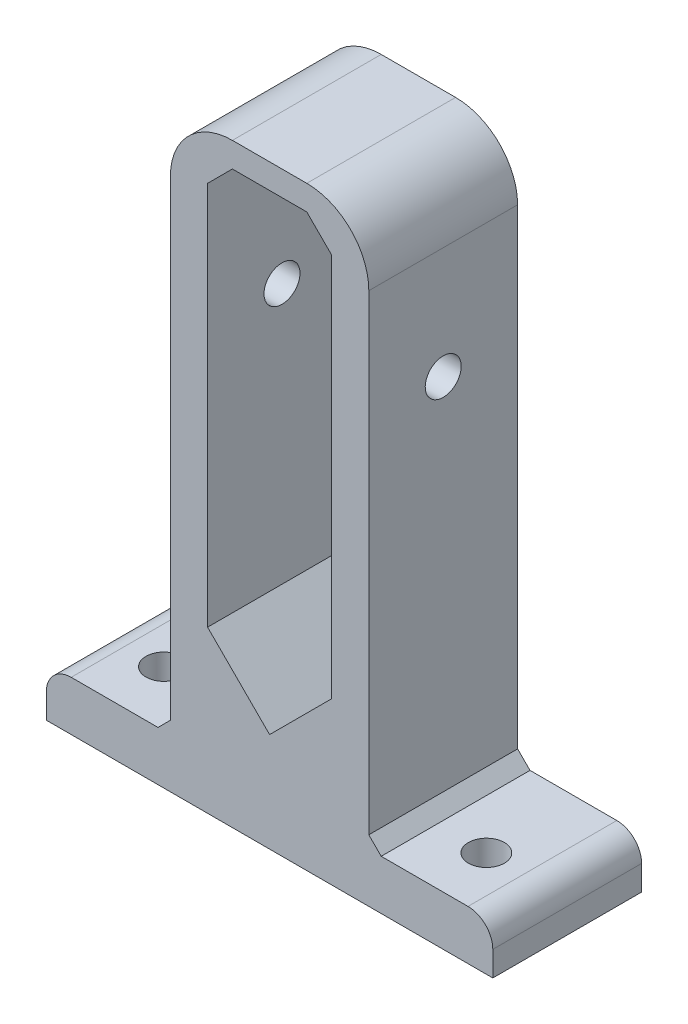
from build123d import *

# Parameters (mm, degrees)
EXTRUDE_1_DEPTH          = 12
CUT_EXTRUDE_1_DEPTH      = 15
CUT_EXTRUDE_1_DEPTH_BACK = 15
SKETCH_2_R               = 1.45
SKETCH_3_R               = 1.45
CUT_EXTRUDE_2_DEPTH      = 15
FILLET_2_R               = 5
FILLET_3_R               = 2
CHAMFER_1_SIZE           = 2
SKETCH_4_W               = 12
SKETCH_4_H               = 8
EXTRUDE_2_DEPTH          = 10
CHAMFER_2_SIZE           = 5
CHAMFER_3_SIZE           = 1


with BuildPart() as part:
    # 草图1 → 凸台-拉伸1 (new body)
    with BuildSketch(Plane.XY):
        Polygon((0, 0), (13, 0), (13, 46), (23, 46), (23, 0), (36, 0), (36, 4), (26, 4), (26, 48), (10, 48), (10, 4), (0, 4), align=None)
    extrude(amount=EXTRUDE_1_DEPTH)

    # 草图2 → 切除-拉伸1 (cut, two sides: drawn at the far end of the back side and taken through both)
    with BuildSketch(Plane(origin=(13, 0, 0), x_dir=(0, 0, -1), z_dir=(1, 0, 0)).offset(-CUT_EXTRUDE_1_DEPTH_BACK)):
        with Locations(Location((-6, 34, 0), (0, 0, 180))):
            Circle(SKETCH_2_R)
    extrude(amount=CUT_EXTRUDE_1_DEPTH + CUT_EXTRUDE_1_DEPTH_BACK, mode=Mode.SUBTRACT)

    # 草图3 → 切除-拉伸2 (cut)
    with BuildSketch(Plane(origin=(0, 4, 0), x_dir=(1, 0, 0), z_dir=(0, 1, 0))):
        with Locations(Location((5, -7.519173445, 0), (0, 0, 180))):
            Circle(SKETCH_3_R)
        with Locations(Location((31, -7.519173445, 0), (0, 0, 180))):
            Circle(SKETCH_3_R)
    extrude(amount=-CUT_EXTRUDE_2_DEPTH, mode=Mode.SUBTRACT)

    # 圆角2
    fillet_2_edges = [part.edges().sort_by_distance(p)[0] for p in [
        (10, 48, 6),
        (26, 48, 6),
    ]]
    fillet(fillet_2_edges, radius=FILLET_2_R)

    # 圆角3
    fillet_3_edges = [part.edges().sort_by_distance(p)[0] for p in [
        (0, 4, 6),
        (36, 4, 6),
    ]]
    fillet(fillet_3_edges, radius=FILLET_3_R)

    # 倒角1
    chamfer_1_edges = [part.edges().sort_by_distance(p)[0] for p in [
        (23, 46, 6),
        (13, 46, 6),
    ]]
    chamfer(chamfer_1_edges, length=CHAMFER_1_SIZE)

    # 草图4 → 凸台-拉伸2 (add)
    with BuildSketch(Plane(origin=(13, 0, 0), x_dir=(0, 0, -1), z_dir=(1, 0, 0))):
        with Locations((-6, 4)):
            Rectangle(SKETCH_4_W, SKETCH_4_H)
    extrude(amount=EXTRUDE_2_DEPTH)

    # 倒角2
    chamfer_2_edges = [part.edges().sort_by_distance(p)[0] for p in [
        (13, 8, 6),
        (23, 8, 6),
    ]]
    chamfer(chamfer_2_edges, length=CHAMFER_2_SIZE - 0.0001)  # a hair under: the kernel refuses the full size

    # 倒角3
    chamfer_3_edges = [part.edges().sort_by_distance(p)[0] for p in [
        (10, 4, 6),
        (26, 4, 6),
    ]]
    chamfer(chamfer_3_edges, length=CHAMFER_3_SIZE)


solid = part.part
